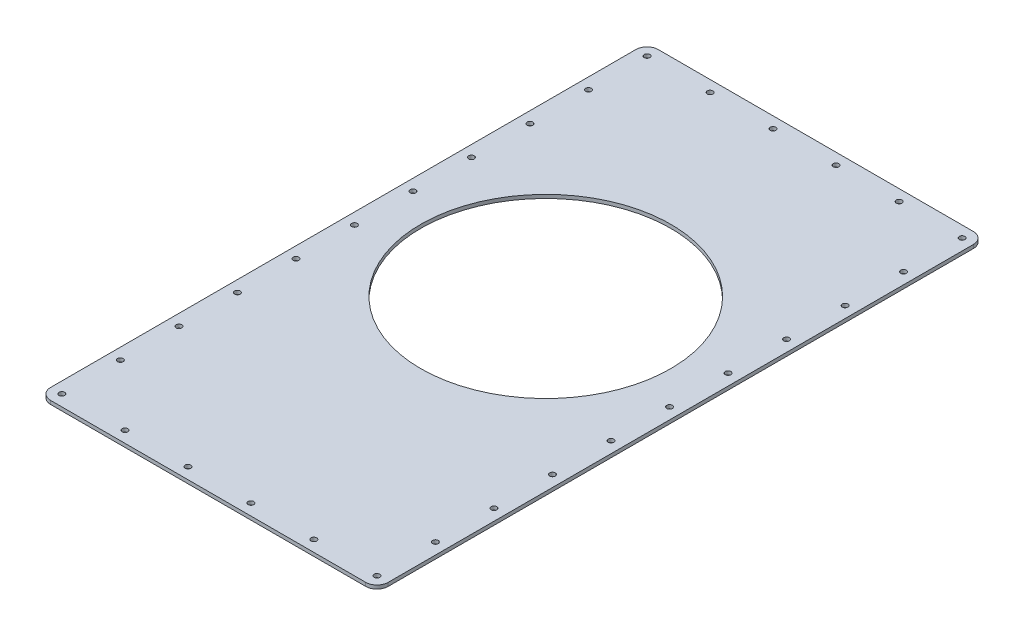
from build123d import *

# Parameters (mm, degrees)
SKETCH9_W               = 300
SKETCH9_H               = 540
SKETCH9_R               = 2.5
BOSS_EXTRUDE7_DEPTH     = 3.175
FILLET4_R               = 10
CUT_EXTRUDE1_DEPTH      = 543.618724912
CUT_EXTRUDE1_DEPTH_BACK = 543.618724912
SKETCH9_3_R             = 111.125


with BuildPart() as part:
    # Sketch9 → Boss-Extrude7 (new body)
    with BuildSketch(Plane(origin=(0, 0, 0), x_dir=(1, 0, 0), z_dir=(0, 1, 0))):
        with Locations((5, 250)):
            Rectangle(SKETCH9_W, SKETCH9_H)
        with Locations((-135, -10)):
            Circle(SKETCH9_R, mode=Mode.SUBTRACT)
        with Locations((-135, 42)):
            Circle(SKETCH9_R, mode=Mode.SUBTRACT)
        with Locations((-79, -10)):
            Circle(SKETCH9_R, mode=Mode.SUBTRACT)
        with Locations((-135, 94)):
            Circle(SKETCH9_R, mode=Mode.SUBTRACT)
        with Locations((-23, -10)):
            Circle(SKETCH9_R, mode=Mode.SUBTRACT)
        with Locations((-135, 146)):
            Circle(SKETCH9_R, mode=Mode.SUBTRACT)
        with Locations((-135, 198)):
            Circle(SKETCH9_R, mode=Mode.SUBTRACT)
        with Locations((33, -10)):
            Circle(SKETCH9_R, mode=Mode.SUBTRACT)
        with Locations((89, -10)):
            Circle(SKETCH9_R, mode=Mode.SUBTRACT)
        with Locations((145, -10)):
            Circle(SKETCH9_R, mode=Mode.SUBTRACT)
        with Locations((145, 42)):
            Circle(SKETCH9_R, mode=Mode.SUBTRACT)
        with Locations((145, 94)):
            Circle(SKETCH9_R, mode=Mode.SUBTRACT)
        with Locations((145, 146)):
            Circle(SKETCH9_R, mode=Mode.SUBTRACT)
        with Locations((145, 198)):
            Circle(SKETCH9_R, mode=Mode.SUBTRACT)
        with Locations((-135, 250)):
            Circle(SKETCH9_R, mode=Mode.SUBTRACT)
        with Locations((-135, 302)):
            Circle(SKETCH9_R, mode=Mode.SUBTRACT)
        with Locations((-135, 354)):
            Circle(SKETCH9_R, mode=Mode.SUBTRACT)
        with Locations((-135, 406)):
            Circle(SKETCH9_R, mode=Mode.SUBTRACT)
        with Locations((-135, 458)):
            Circle(SKETCH9_R, mode=Mode.SUBTRACT)
        with Locations((-135, 510)):
            Circle(SKETCH9_R, mode=Mode.SUBTRACT)
        with Locations((-79, 510)):
            Circle(SKETCH9_R, mode=Mode.SUBTRACT)
        with Locations((-23, 510)):
            Circle(SKETCH9_R, mode=Mode.SUBTRACT)
        with Locations((145, 250)):
            Circle(SKETCH9_R, mode=Mode.SUBTRACT)
        with Locations((145, 302)):
            Circle(SKETCH9_R, mode=Mode.SUBTRACT)
        with Locations((145, 354)):
            Circle(SKETCH9_R, mode=Mode.SUBTRACT)
        with Locations((33, 510)):
            Circle(SKETCH9_R, mode=Mode.SUBTRACT)
        with Locations((145, 406)):
            Circle(SKETCH9_R, mode=Mode.SUBTRACT)
        with Locations((89, 510)):
            Circle(SKETCH9_R, mode=Mode.SUBTRACT)
        with Locations((145, 458)):
            Circle(SKETCH9_R, mode=Mode.SUBTRACT)
        with Locations((145, 510)):
            Circle(SKETCH9_R, mode=Mode.SUBTRACT)
    extrude(amount=BOSS_EXTRUDE7_DEPTH)

    # Fillet4
    fillet4_edges = [part.edges().sort_by_distance(p)[0] for p in [
        (-145, 1.5875, -520),
        (155, 1.5875, -520),
        (155, 1.5875, 20),
        (-145, 1.5875, 20),
    ]]
    fillet(fillet4_edges, radius=FILLET4_R)

    # Sketch9<3> → Cut-Extrude1 (cut, two sides: drawn at the far end of the back side and taken through both)
    with BuildSketch(Plane(origin=(0, 0, 0), x_dir=(1, 0, 0), z_dir=(0, 1, 0)).offset(-CUT_EXTRUDE1_DEPTH_BACK)):
        with Locations((5, 280)):
            Circle(SKETCH9_3_R)
    extrude(amount=CUT_EXTRUDE1_DEPTH + CUT_EXTRUDE1_DEPTH_BACK, mode=Mode.SUBTRACT)


solid = part.part
